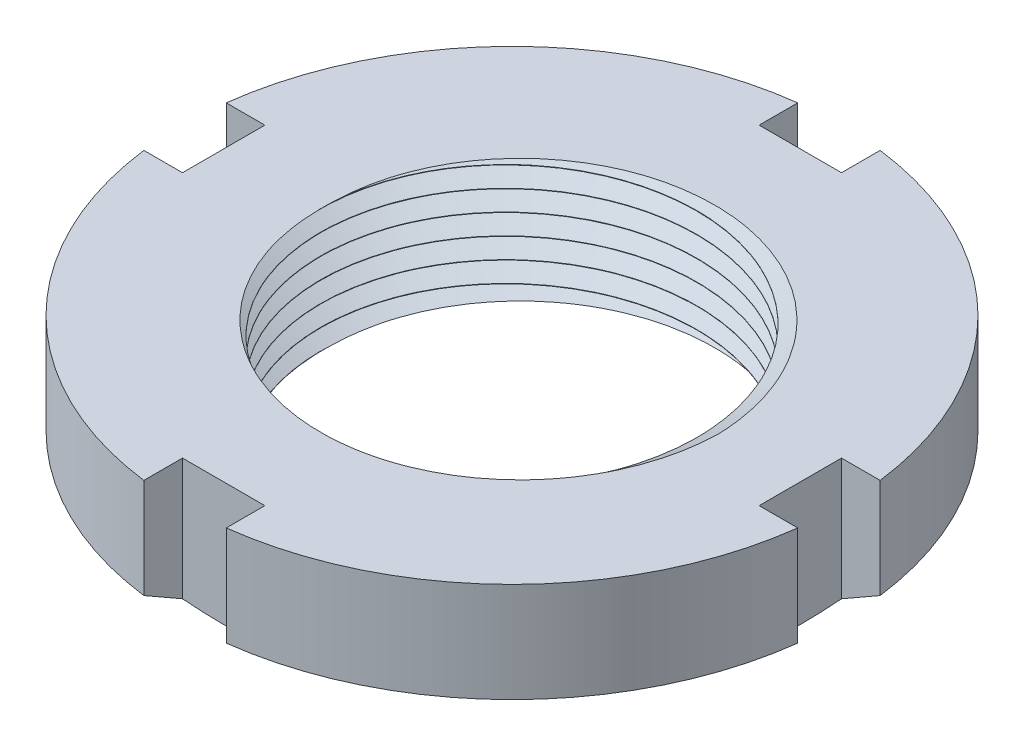
from build123d import *

# Parameters (mm, degrees)
ESQUISSE2_W    = 4
ESQUISSE2_H    = 2
ESQUISSE2_W_2  = 2
ESQUISSE2_H_2  = 4
ENCOCHES_DEPTH = 27.305892876
FILETAGE_PITCH = 1


with BuildPart() as part:
    # Esquisse1 → Base (revolve)
    with BuildSketch(Plane.XY, mode=Mode.PRIVATE) as base_sk:
        Polygon((9.133974596, 6), (16, 6), (16, 1.154700538), (14, 0), (9.133974596, 0), align=None)
    revolve(base_sk.sketch.rotate(Axis((0, 0, 0), (0, 1, 0)), 90), axis=Axis((0, 0, 0), (0, 1, 0)))

    # Esquisse2 → Encoches (cut, through all)
    with BuildSketch(Plane(origin=(0, 6, -4), x_dir=(1, 0, 0), z_dir=(0, -1, 0))):
        with Locations((0, -11)):
            Rectangle(ESQUISSE2_W, ESQUISSE2_H)
        with Locations((0, 19)):
            Rectangle(ESQUISSE2_W, ESQUISSE2_H)
        with Locations((15, 4)):
            Rectangle(ESQUISSE2_W_2, ESQUISSE2_H_2)
        with Locations((-15, 4)):
            Rectangle(ESQUISSE2_W_2, ESQUISSE2_H_2)
    extrude(amount=ENCOCHES_DEPTH, mode=Mode.SUBTRACT)

    # Filetage: the profile of Esquisse4 screwed along a right-hand helix of 8 turns, 8 arcs to a turn; built about Z, then put on its axis
    filetage_z = Axis((0, 0, 0), (0, 0, 1))
    filetage_corners = [(10, 0, 0), (9.120940747, 0, 0.497347796), (9.120940747, 0, 0.25), (8.620940747, 0, 0.25), (8.620940747, 0, -0.25), (9.120940747, 0, -0.25), (9.120940747, 0, -0.497347796)]
    with BuildLine(mode=Mode.PRIVATE) as filetage_profile:
        Line(filetage_corners[0], filetage_corners[1])
        Line(filetage_corners[1], filetage_corners[2])
        Line(filetage_corners[2], filetage_corners[3])
        Line(filetage_corners[3], filetage_corners[4])
        Line(filetage_corners[4], filetage_corners[5])
        Line(filetage_corners[5], filetage_corners[6])
        Line(filetage_corners[6], filetage_corners[0])
    filetage_cap = Face(filetage_profile.wire())
    filetage_turn_angles = [0, 22.5, 45, 67.5, 90, 112.5, 135, 157.5, 180, 202.5, 225, 247.5, 270, 292.5, 315, 337.5, 360]
    filetage_turn_weights = [1, 0.9238795325112867, 1, 0.9238795325112867, 1, 0.9238795325112867, 1, 0.9238795325112867, 1, 0.9238795325112867, 1, 0.9238795325112867, 1, 0.9238795325112867, 1, 0.9238795325112867, 1]
    filetage_turn_rails = [Edge.make_bspline([Vector(p[0], p[1], 0).rotate(filetage_z, filetage_turn_angles[k]) / filetage_turn_weights[k] + Vector(0, 0, p[2] + FILETAGE_PITCH * filetage_turn_angles[k] / 360) for k in range(17)], [0, 0, 0, 1, 1, 2, 2, 3, 3, 4, 4, 5, 5, 6, 6, 7, 7, 8, 8, 8], 2, filetage_turn_weights) for p in filetage_corners]
    filetage_turn_sides = [Face.make_surface_from_curves(filetage_turn_rails[p[0]], filetage_turn_rails[p[1]]) for p in [(0, 1), (1, 2), (2, 3), (3, 4), (4, 5), (5, 6), (6, 0)]]
    filetage = Plane(origin=(0, -1, 0), x_dir=(1, 0, 0), z_dir=(0, 1, 0)) * Solid(Shell([*[p.moved(Location((0, 0, FILETAGE_PITCH * i))) for i in range(8) for p in filetage_turn_sides], filetage_cap, filetage_cap.rotate(filetage_z, 2880).moved(Location((0, 0, FILETAGE_PITCH * 2880 / 360)))]))
    add(filetage, mode=Mode.SUBTRACT)


solid = part.part
